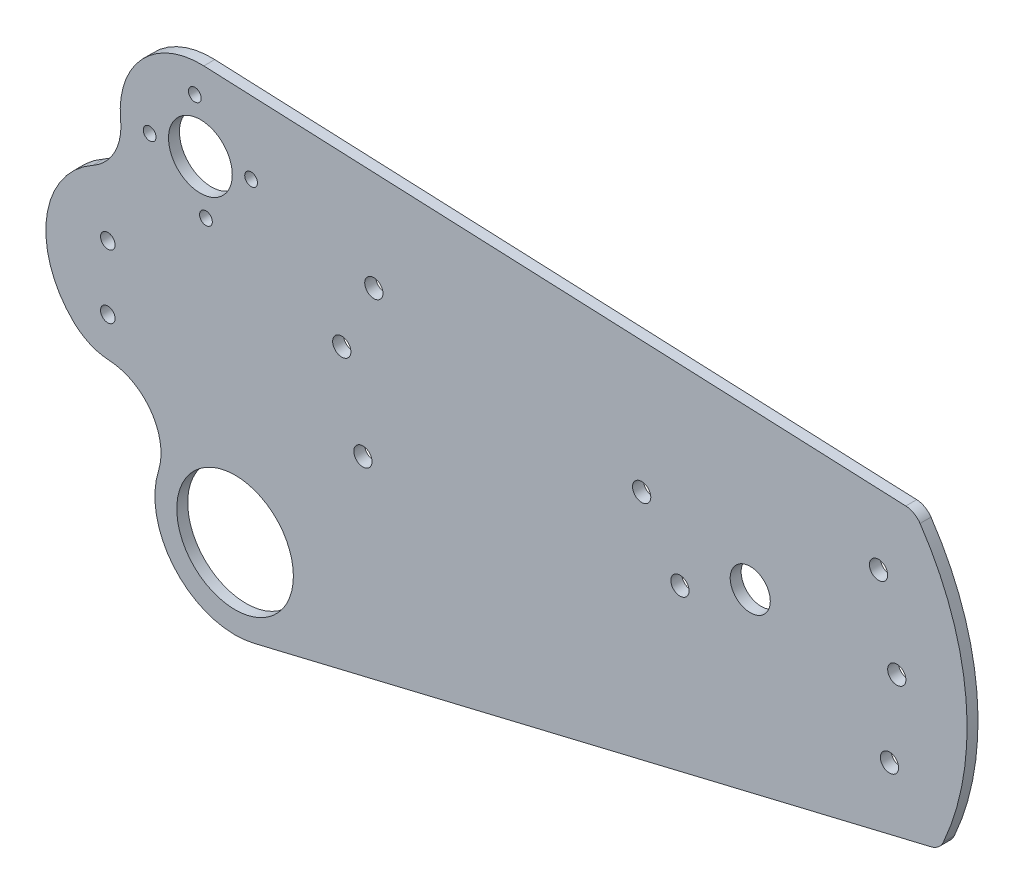
from build123d import *

# Parameters (mm, degrees)
SKETCH1_R           = 2.5
SKETCH1_R_2         = 5.5
SKETCH1_R_3         = 2
SKETCH1_R_4         = 16
SKETCH1_R_5         = 1.75
SKETCH1_R_6         = 8.75
BOSS_EXTRUDE1_DEPTH = 3


with BuildPart() as part:
    # Sketch1 → Boss-Extrude1 (new body)
    with BuildSketch(Plane.XY):
        with BuildLine():
            ThreePointArc((-111.950715529, 49.479735972), (-128.905207802, 42.58858293), (-134.779975779, 25.255669161))
            ThreePointArc((-134.779975779, 25.255669161), (-136.404923722, 16.783164051), (-142.428084942, 10.606973672))
            ThreePointArc((-142.428084942, 10.606973672), (-155.103165518, -8.083982432), (-147.542861296, -29.364285714))
            ThreePointArc((-147.542861296, -29.364285714), (-143.115756131, -32.284342925), (-137.949200533, -33.481296357))
            ThreePointArc((-137.949200533, -33.481296357), (-126.396780817, -39.878943115), (-124.378562742, -52.929425143))
            ThreePointArc((-124.378562742, -52.929425143), (-119.446076907, -74.506556005), (-98.248224362, -80.874682909))
            Line((-98.248224362, -80.874682909), (87.599807842, -36.324124584))
            ThreePointArc((87.599807842, -36.324124584), (89.628916585, -35.308187267), (91, -33.5))
            ThreePointArc((91, -33.5), (97.209938145, 3.589892519), (84.596761266, 39.017723779))
            ThreePointArc((84.596761266, 39.017723779), (82.894729676, 40.577563058), (80.673357692, 41.206464173))
            Line((80.673357692, 41.206464173), (-111.950715529, 49.479735972))
        make_face()
        with Locations((73.2, 22.3)):
            Circle(SKETCH1_R, mode=Mode.SUBTRACT)
        with Locations((76.2, -22)):
            Circle(SKETCH1_R, mode=Mode.SUBTRACT)
        with Locations((18.7, -8.7)):
            Circle(SKETCH1_R, mode=Mode.SUBTRACT)
        with Locations((8.2, 8.3)):
            Circle(SKETCH1_R, mode=Mode.SUBTRACT)
        with Locations((37.99200096, 0)):
            Circle(SKETCH1_R_2, mode=Mode.SUBTRACT)
        with Locations((78.2, -0.1)):
            Circle(SKETCH1_R, mode=Mode.SUBTRACT)
        with Locations((-138.3, -22.75)):
            Circle(SKETCH1_R_3, mode=Mode.SUBTRACT)
        with Locations((-68.3, -21.5)):
            Circle(SKETCH1_R, mode=Mode.SUBTRACT)
        with Locations((-138.3, -5.25)):
            Circle(SKETCH1_R_3, mode=Mode.SUBTRACT)
        with Locations((-74.1, 1.7)):
            Circle(SKETCH1_R, mode=Mode.SUBTRACT)
        with Locations((-65.3, 20)):
            Circle(SKETCH1_R, mode=Mode.SUBTRACT)
        with Locations((-103.376663833, -59.480779371)):
            Circle(SKETCH1_R_4, mode=Mode.SUBTRACT)
        with Locations((-98.977828232, 29.022894256)):
            Circle(SKETCH1_R_5, mode=Mode.SUBTRACT)
        with Locations((-114.417647187, 41.416924699)):
            Circle(SKETCH1_R_5, mode=Mode.SUBTRACT)
        with Locations((-111.371858676, 13.583075301)):
            Circle(SKETCH1_R_5, mode=Mode.SUBTRACT)
        with Locations((-126.811677631, 25.977105744)):
            Circle(SKETCH1_R_5, mode=Mode.SUBTRACT)
        with Locations((-112.894752932, 27.5)):
            Circle(SKETCH1_R_6, mode=Mode.SUBTRACT)
    extrude(amount=BOSS_EXTRUDE1_DEPTH)


solid = part.part
